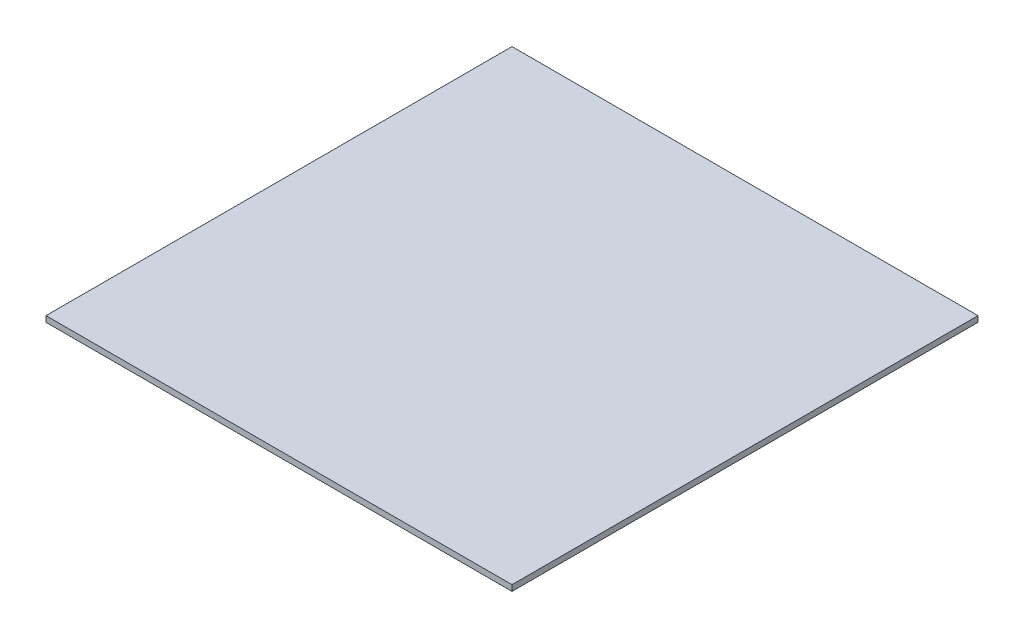
from build123d import *

# Parameters (mm, degrees)
SKETCH_1_W      = 320
SKETCH_1_H      = 320
EXTRUDE_1_DEPTH = 4


with BuildPart() as part:
    # Эскиз1 → Бобышка-Вытянуть1 (new body)
    with BuildSketch(Plane(origin=(0, 0, 0), x_dir=(1, 0, 0), z_dir=(0, 1, 0))):
        Rectangle(SKETCH_1_W, SKETCH_1_H)
    extrude(amount=EXTRUDE_1_DEPTH)


solid = part.part
